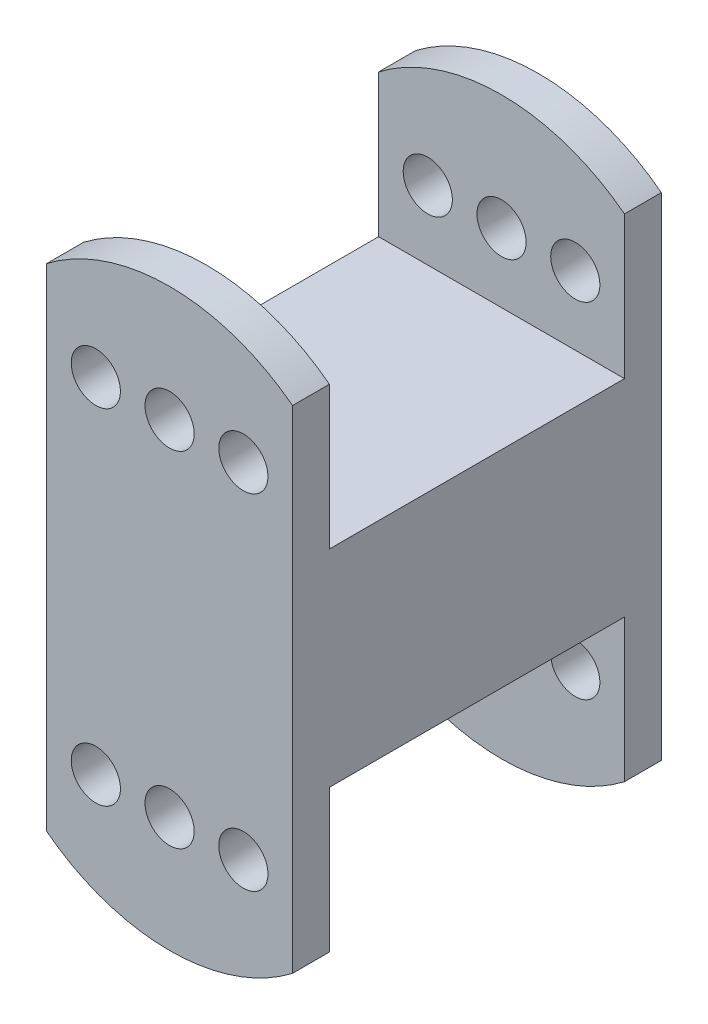
from build123d import *

# Parameters (mm, degrees)
SKETCH1_R           = 2
BOSS_EXTRUDE1_DEPTH = 30
SKETCH2_W           = 24
SKETCH2_H           = 15
CUT_EXTRUDE1_DEPTH  = 48.136701039


with BuildPart() as part:
    # Sketch1 → Boss-Extrude1 (new body)
    with BuildSketch(Plane.XY):
        with BuildLine():
            Line((-10, -13.032253728), (-10, 26.967746272))
            ThreePointArc((-10, 26.967746272), (0, 30.36228886), (10, 26.967746272))
            Line((10, 26.967746272), (10, -13.032253728))
            ThreePointArc((10, -13.032253728), (0, -16.426796317), (-10, -13.032253728))
        make_face()
        with Locations((0, -7.032253728)):
            Circle(SKETCH1_R, mode=Mode.SUBTRACT)
        with Locations((6, -7.032253728)):
            Circle(SKETCH1_R, mode=Mode.SUBTRACT)
        with Locations((-6, -7.032253728)):
            Circle(SKETCH1_R, mode=Mode.SUBTRACT)
        with Locations((6, 20.967746272)):
            Circle(SKETCH1_R, mode=Mode.SUBTRACT)
        with Locations((0, 20.967746272)):
            Circle(SKETCH1_R, mode=Mode.SUBTRACT)
        with Locations((-6, 20.967746272)):
            Circle(SKETCH1_R, mode=Mode.SUBTRACT)
    extrude(amount=BOSS_EXTRUDE1_DEPTH)

    # Sketch2 → Cut-Extrude1 (cut, through all)
    with BuildSketch(Plane(origin=(10, 0, 0), x_dir=(0, 0, -1), z_dir=(1, 0, 0))):
        with Locations((-15, -8.926796317)):
            Rectangle(SKETCH2_W, SKETCH2_H)
        with Locations((-15, 22.86228886)):
            Rectangle(SKETCH2_W, SKETCH2_H)
    extrude(amount=-CUT_EXTRUDE1_DEPTH, mode=Mode.SUBTRACT)


solid = part.part
